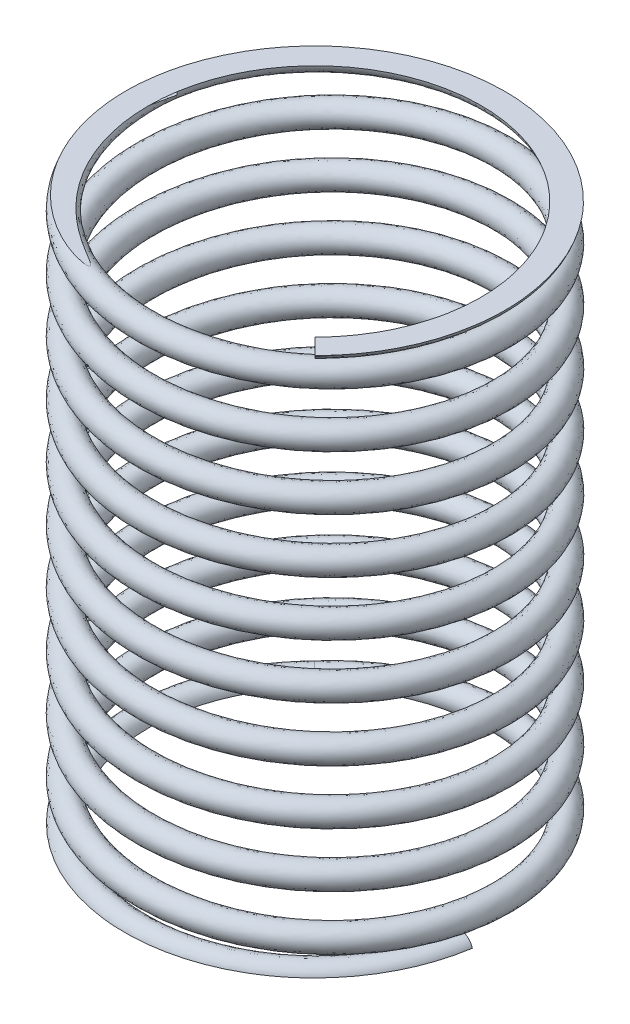
from build123d import *

# Parameters (mm, degrees)
SWEEP1_PITCH            = 7.272727272727237
SWEEP1_HEIGHT           = 72.00000000000001
SWEEP1_RADIUS           = 23.775000000000002
SWEEP1_START_ANGLE      = -134.9999999999995
SWEEP1_PROFILE_R        = 1.625
SWEEP2_PITCH            = 0.9999999999999987
SWEEP3_PITCH            = 1.0000000000000036
CUT_EXTRUDE1_DEPTH      = 83.46009074265844
CUT_EXTRUDE1_DEPTH_BACK = 83.46009074265844


with BuildPart() as part:
    # Sweep1: sweep along a helix
    with BuildLine() as sweep1_path:
        add(Helix(SWEEP1_PITCH, SWEEP1_HEIGHT, SWEEP1_RADIUS, center=(0, 0, 0), direction=(0, 1, 0), lefthand=True, mode=Mode.PRIVATE).rotate(Axis((0, 0, 0), (0, 1, 0)), SWEEP1_START_ANGLE))
    # Sweep1 profile (on start of the path) → Sweep1 (sweep)
    with BuildSketch(Plane(origin=(-16.811463722710325, 0, -16.81146372271002), x_dir=(-0.7071067811865659, 0, -0.7071067811865293), z_dir=(0.7062702586986294, 0.04862759870166974, -0.706270258698666))):
        Circle(SWEEP1_PROFILE_R)
    sweep(path=sweep1_path.line, is_frenet=True)

    # Sweep2: the profile of Sweep2 profile screwed along a left-hand helix of 0.6 turns, 8 arcs to a turn; built about Z, then put on its axis
    sweep2_z = Axis((0, 0, 0), (0, 0, 1))
    sweep2_corners = [(22.15, 0, 0), (23.775, -0.010877854, -1.624963591), (25.4, 0, 0), (23.775, 0.010877854, 1.624963591)]
    with BuildLine(mode=Mode.PRIVATE) as sweep2_profile:
        ThreePointArc((22.15, 0, 0), (22.625951481, -0.007691805, -1.149022774), (23.775, -0.010877854, -1.624963591))
        ThreePointArc((23.775, -0.010877854, -1.624963591), (24.924048519, -0.007691805, -1.149022774), (25.4, 0, 0))
        ThreePointArc((25.4, 0, 0), (24.924048519, 0.007691805, 1.149022774), (23.775, 0.010877854, 1.624963591))
        ThreePointArc((23.775, 0.010877854, 1.624963591), (22.625951481, 0.007691805, 1.149022774), (22.15, 0, 0))
    sweep2_cap = Face(sweep2_profile.wire())
    sweep2_arcs = [((22.15, 0, 0), (22.15, -0.010877854, -1.624963591), (23.775, -0.010877854, -1.624963591), (1, 0.7071067811865477, 1)), ((23.775, -0.010877854, -1.624963591), (25.4, -0.010877854, -1.624963591), (25.4, 0, 0), (1, 0.7071067811865477, 1)), ((25.4, 0, 0), (25.4, 0.010877854, 1.624963591), (23.775, 0.010877854, 1.624963591), (1, 0.7071067811865477, 1)), ((23.775, 0.010877854, 1.624963591), (22.15, 0.010877854, 1.624963591), (22.15, 0, 0), (1, 0.7071067811865477, 1))]  # start, shoulder, end, weights
    sweep2_turn_angles = [0, -22.5, -45, -67.5, -90, -112.5, -135, -157.5, -180, -198, -216]
    sweep2_turn_weights = [1, 0.9238795325112867, 1, 0.9238795325112867, 1, 0.9238795325112867, 1, 0.9238795325112867, 1, 0.9510565162951525, 1]
    sweep2_turn_sides = [Face.make_bezier_surface([[Vector(p[j][0], p[j][1], 0).rotate(sweep2_z, sweep2_turn_angles[2 * i + k]) / sweep2_turn_weights[2 * i + k] + Vector(0, 0, p[j][2] + -SWEEP2_PITCH * sweep2_turn_angles[2 * i + k] / 360) for k in range(3)] for j in range(3)], [[p[3][j] * sweep2_turn_weights[2 * i + k] for k in range(3)] for j in range(3)]) for p in sweep2_arcs for i in range(5)]
    sweep2 = Plane(origin=(0, 0, 0), x_dir=(-0.7071067811865537, 0, -0.7071067811865415), z_dir=(0, -1, 0)) * Solid(Shell([*sweep2_turn_sides, sweep2_cap, sweep2_cap.rotate(sweep2_z, -216).moved(Location((0, 0, -SWEEP2_PITCH * -216 / 360)))]))
    add(sweep2)

    # Sweep3: the profile of Sweep3 profile screwed along a left-hand helix of 0.6 turns, 8 arcs to a turn; built about Z, then put on its axis
    sweep3_z = Axis((0, 0, 0), (0, 0, 1))
    sweep3_corners = [(25.4, 0, 0), (23.775, 0.010877854, 1.624963591), (22.15, 0, 0), (23.775, -0.010877854, -1.624963591)]
    with BuildLine(mode=Mode.PRIVATE) as sweep3_profile:
        ThreePointArc((25.4, 0, 0), (24.924048519, 0.007691805, 1.149022774), (23.775, 0.010877854, 1.624963591))
        ThreePointArc((23.775, 0.010877854, 1.624963591), (22.625951481, 0.007691805, 1.149022774), (22.15, 0, 0))
        ThreePointArc((22.15, 0, 0), (22.625951481, -0.007691805, -1.149022774), (23.775, -0.010877854, -1.624963591))
        ThreePointArc((23.775, -0.010877854, -1.624963591), (24.924048519, -0.007691805, -1.149022774), (25.4, 0, 0))
    sweep3_cap = Face(sweep3_profile.wire())
    sweep3_arcs = [((25.4, 0, 0), (25.4, 0.010877854, 1.624963591), (23.775, 0.010877854, 1.624963591), (1, 0.7071067811865477, 1)), ((23.775, 0.010877854, 1.624963591), (22.15, 0.010877854, 1.624963591), (22.15, 0, 0), (1, 0.7071067811865477, 1)), ((22.15, 0, 0), (22.15, -0.010877854, -1.624963591), (23.775, -0.010877854, -1.624963591), (1, 0.7071067811865477, 1)), ((23.775, -0.010877854, -1.624963591), (25.4, -0.010877854, -1.624963591), (25.4, 0, 0), (1, 0.7071067811865477, 1))]  # start, shoulder, end, weights
    sweep3_turn_angles = [0, -22.5, -45, -67.5, -90, -112.5, -135, -157.5, -180, -198, -216]
    sweep3_turn_weights = [1, 0.9238795325112867, 1, 0.9238795325112867, 1, 0.9238795325112867, 1, 0.9238795325112867, 1, 0.9510565162951524, 1]
    sweep3_turn_sides = [Face.make_bezier_surface([[Vector(p[j][0], p[j][1], 0).rotate(sweep3_z, sweep3_turn_angles[2 * i + k]) / sweep3_turn_weights[2 * i + k] + Vector(0, 0, p[j][2] + -SWEEP3_PITCH * sweep3_turn_angles[2 * i + k] / 360) for k in range(3)] for j in range(3)], [[p[3][j] * sweep3_turn_weights[2 * i + k] for k in range(3)] for j in range(3)]) for p in sweep3_arcs for i in range(5)]
    sweep3 = Plane(origin=(0, 72, 0), x_dir=(-0.9876883405951339, 0, -0.15643446504025563), z_dir=(0, 1, 0)) * Solid(Shell([*sweep3_turn_sides, sweep3_cap, sweep3_cap.rotate(sweep3_z, -216).moved(Location((0, 0, -SWEEP3_PITCH * -216 / 360)))]))
    add(sweep3)

    # Sketch46 → Cut-Extrude1 (cut, two sides: drawn at the far end of the back side and taken through both)
    with BuildSketch(Plane.XY.offset(-CUT_EXTRUDE1_DEPTH_BACK)):
        Polygon((-30, -3.8e-16), (30, -3.8e-16), (30, -9.999999999999993), (-30, -10), align=None)
        Polygon((-29.999999999999993, 72), (29.999999999999993, 72), (29.999999999999996, 81.99999999999999), (-29.999999999999996, 81.99999999999999), align=None)
    extrude(amount=CUT_EXTRUDE1_DEPTH + CUT_EXTRUDE1_DEPTH_BACK, mode=Mode.SUBTRACT)


solid = part.part
